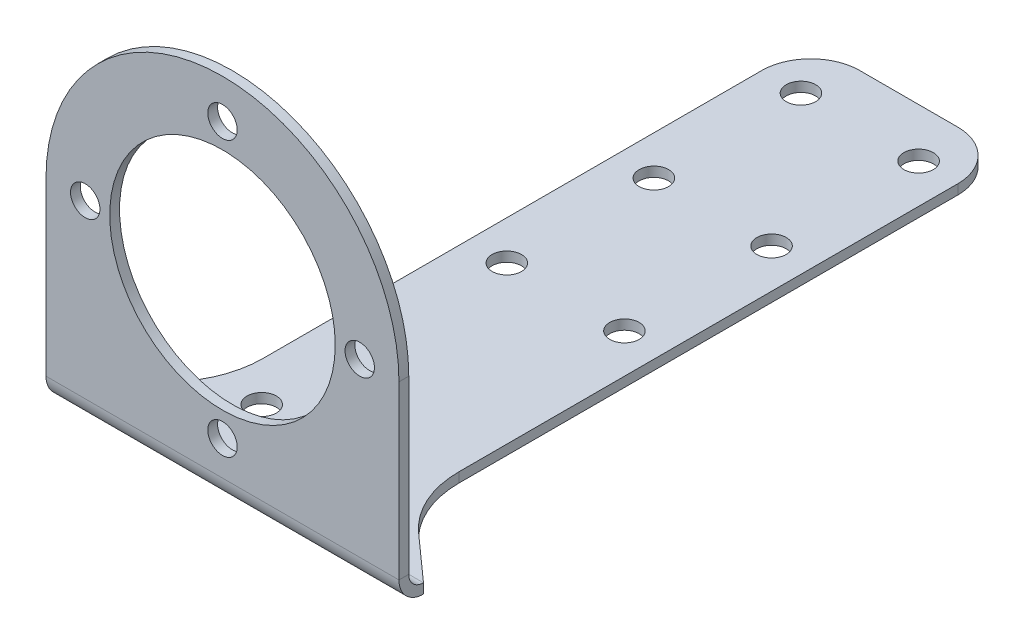
from build123d import *

# Parameters (mm, degrees)
BOSS_EXTRUDE1_DEPTH          = 1
EDGE_FLANGE1_STRIP_W         = 7
EDGE_FLANGE1_STRIP_H         = 1
EDGE_FLANGE1_STRIP_CUT_DEPTH = 36
EDGE_FLANGE1_DEPTH           = 36
SKETCH12_R                   = 1.5
CUT_EXTRUDE2_DEPTH           = 1
FILLET1_R                    = 5


# Sheet-metal steps are written as plain solids
with BuildPart() as part:
    # Sketch1 → Boss-Extrude1 (new body)
    with BuildSketch(Plane.XY):
        with BuildLine():
            Line((11.5, 10), (12.5, 10))
            ThreePointArc((12.5, 10), (12.911299923, 11.031858587), (13.919642857, 11.49784603))
            ThreePointArc((13.919642857, 11.49784603), (9.899494937, 19.899494937), (1.49784603, 23.919642857))
            ThreePointArc((1.49784603, 23.919642857), (0, 22.5), (-1.49784603, 23.919642857))
            ThreePointArc((-1.49784603, 23.919642857), (-9.899494937, 19.899494937), (-13.919642857, 11.49784603))
            ThreePointArc((-13.919642857, 11.49784603), (-12.911299923, 11.031858587), (-12.5, 10))
            Line((-12.5, 10), (-11.5, 10))
            ThreePointArc((-11.5, 10), (0, 21.5), (11.5, 10))
        make_face()
        with BuildLine():
            ThreePointArc((13.919642857, 11.49784603), (15.031858587, 11.088700077), (15.5, 10))
            Line((15.5, 10), (18, 10))
            ThreePointArc((18, 10), (0, 28), (-18, 10))
            Line((-18, 10), (-15.5, 10))
            ThreePointArc((-15.5, 10), (-15.031858587, 11.088700077), (-13.919642857, 11.49784603))
            ThreePointArc((-13.919642857, 11.49784603), (-9.899494937, 19.899494937), (-1.49784603, 23.919642857))
            ThreePointArc((-1.49784603, 23.919642857), (-0.040193003, 25.499461411), (1.5, 24))
            ThreePointArc((1.5, 24), (1.499461411, 23.959806997), (1.49784603, 23.919642857))
            ThreePointArc((1.49784603, 23.919642857), (9.899494937, 19.899494937), (13.919642857, 11.49784603))
        make_face()
        with BuildLine():
            ThreePointArc((13.919642857, 8.50215397), (12.911299923, 8.968141413), (12.5, 10))
            Line((12.5, 10), (11.5, 10))
            ThreePointArc((11.5, 10), (0, -1.5), (-11.5, 10))
            Line((-11.5, 10), (-12.5, 10))
            ThreePointArc((-12.5, 10), (-12.911299923, 8.968141413), (-13.919642857, 8.50215397))
            ThreePointArc((-13.919642857, 8.50215397), (-9.899494937, 0.100505063), (-1.49784603, -3.919642857))
            ThreePointArc((-1.49784603, -3.919642857), (0, -2.5), (1.49784603, -3.919642857))
            ThreePointArc((1.49784603, -3.919642857), (9.899494937, 0.100505063), (13.919642857, 8.50215397))
        make_face()
        with BuildLine():
            Line((18, 10), (15.5, 10))
            ThreePointArc((15.5, 10), (15.031858587, 8.911299923), (13.919642857, 8.50215397))
            ThreePointArc((13.919642857, 8.50215397), (9.899494937, 0.100505063), (1.49784603, -3.919642857))
            ThreePointArc((1.49784603, -3.919642857), (1.499461411, -3.959806997), (1.5, -4))
            ThreePointArc((1.5, -4), (-0.040193003, -5.499461411), (-1.49784603, -3.919642857))
            ThreePointArc((-1.49784603, -3.919642857), (-9.899494937, 0.100505063), (-13.919642857, 8.50215397))
            ThreePointArc((-13.919642857, 8.50215397), (-15.031858587, 8.911299923), (-15.5, 10))
            Line((-15.5, 10), (-18, 10))
            ThreePointArc((-18, 10), (0, -8), (18, 10))
        make_face()
        with BuildLine():
            Line((18, -10), (18, 10))
            ThreePointArc((18, 10), (0, -8), (-18, 10))
            Line((-18, 10), (-18, -10))
            Line((-18, -10), (18, -10))
        make_face()
    extrude(amount=BOSS_EXTRUDE1_DEPTH)

    # Edge-Flange1 strip (across the edge) → Edge-Flange1 strip cut (cut)
    with BuildSketch(Plane(origin=(18, -10, 0), x_dir=(0, 1, 0), z_dir=(-1, 0, 0))):
        with Locations((-1, -0.5)):
            Rectangle(EDGE_FLANGE1_STRIP_W, EDGE_FLANGE1_STRIP_H)
    extrude(amount=EDGE_FLANGE1_STRIP_CUT_DEPTH, mode=Mode.SUBTRACT)

    # Edge-Flange1 section (across the edge) → Edge-Flange1 (add)
    with BuildSketch(Plane(origin=(18, -10, 0), x_dir=(0, 1, 0), z_dir=(-1, 0, 0))):
        with BuildLine():
            Line((0, 1.5), (0, 69))
            Line((0, 69), (1, 69))
            Line((1, 69), (1, 1.5))
            ThreePointArc((1, 1.5), (1.439339828, 0.439339828), (2.5, 0))
            Line((2.5, 0), (2.5, -1))
            ThreePointArc((2.5, -1), (0.732233047, -0.267766953), (0, 1.5))
        make_face()
    extrude(amount=EDGE_FLANGE1_DEPTH)

    # Sketch12 → Cut-Extrude2 (cut)
    with BuildSketch(Plane(origin=(0, -9, 0), x_dir=(1, 0, 0), z_dir=(0, 1, 0))):
        with BuildLine():
            Line((-18, 69), (-18, 1.5))
            Line((-18, 1.5), (-13.335935783, 5.66873596))
            ThreePointArc((-13.335935783, 5.66873596), (-10.872003446, 9.040546507), (-10, 13.124622769))
            Line((-10, 13.124622769), (-10, 69))
            Line((-10, 69), (-18, 69))
        make_face()
        with BuildLine():
            Line((13.335935783, 5.66873596), (18, 1.5))
            Line((18, 1.5), (18, 69))
            Line((18, 69), (10, 69))
            Line((10, 69), (10, 13.124622769))
            ThreePointArc((10, 13.124622769), (10.872003446, 9.040546507), (13.335935783, 5.66873596))
        make_face()
        with Locations(Location((-6, 64, 0), (0, 0, 270))):
            Circle(SKETCH12_R)
        with Locations(Location((6, 64, 0), (0, 0, 270))):
            Circle(SKETCH12_R)
        with Locations(Location((-6, 49, 0), (0, 0, 270))):
            Circle(SKETCH12_R)
        with Locations(Location((6, 49, 0), (0, 0, 270))):
            Circle(SKETCH12_R)
        with Locations(Location((-6, 34, 0), (0, 0, 270))):
            Circle(SKETCH12_R)
        with Locations(Location((6, 34, 0), (0, 0, 270))):
            Circle(SKETCH12_R)
        with Locations(Location((-6, 9, 0), (0, 0, 270))):
            Circle(SKETCH12_R)
        with Locations(Location((6, 9, 0), (0, 0, 90))):
            Circle(SKETCH12_R)
    extrude(amount=-CUT_EXTRUDE2_DEPTH, mode=Mode.SUBTRACT)

    # Fillet1
    fillet1_edges = [part.edges().sort_by_distance(p)[0] for p in [
        (10, -9.5, -69),
        (-10, -9.5, -69),
    ]]
    fillet(fillet1_edges, radius=FILLET1_R)


solid = part.part
